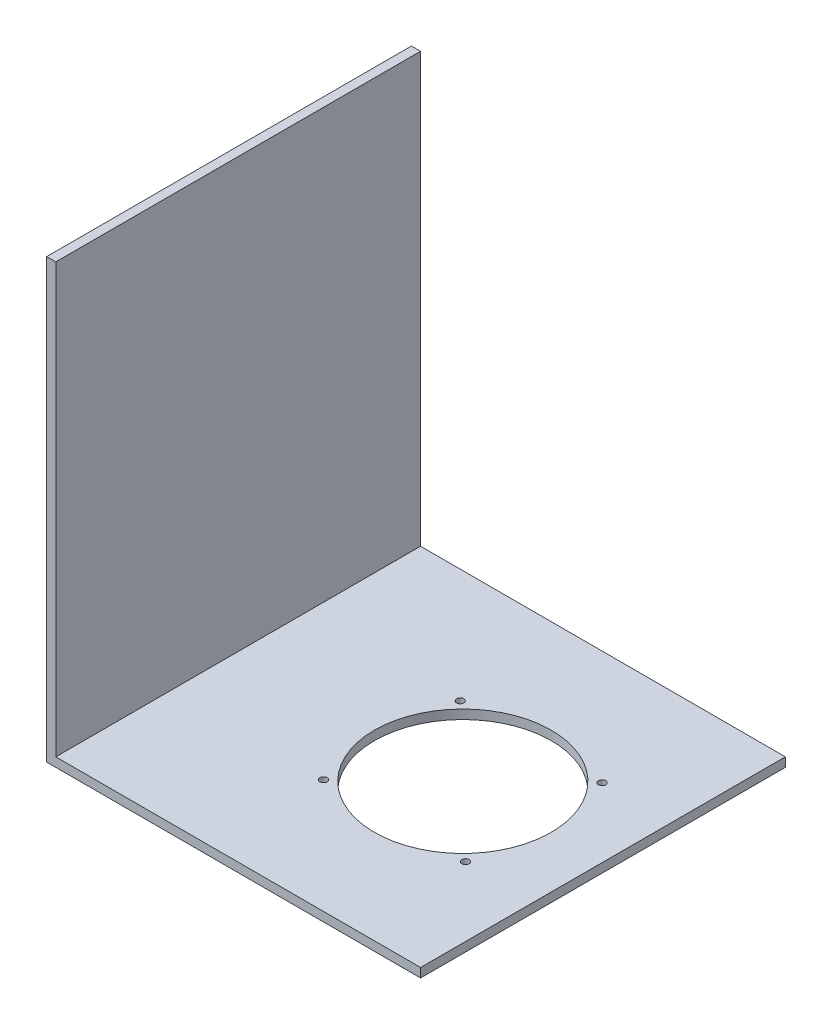
from build123d import *

# Parameters (mm, degrees)
BOSS_EXTRUDE1_DEPTH = 200
CUT_EXTRUDE1_REACH  = 372.473
SKETCH2_R           = 48.5
SKETCH2_R_2         = 2


with BuildPart() as part:
    # Sketch1 → Boss-Extrude1 (new body)
    with BuildSketch(Plane.XY):
        Polygon((0, 240), (0, 0), (205, 0), (205, 5), (5, 5), (5, 240), align=None)
    extrude(amount=BOSS_EXTRUDE1_DEPTH)

    # Sketch2 → Cut-Extrude1 (cut, up to next)
    with BuildSketch(Plane(origin=(0, 5, 0), x_dir=(1, 0, 0), z_dir=(0, 1, 0)), mode=Mode.PRIVATE) as cut_extrude1_sk1:
        with Locations((128.16761425, -100)):
            Circle(SKETCH2_R)
    cut_extrude1_tool1 = extrude(cut_extrude1_sk1.sketch, amount=-CUT_EXTRUDE1_REACH, mode=Mode.PRIVATE) & part.part
    # Sketch2 → Cut-Extrude1 (cut, up to next)
    with BuildSketch(Plane(origin=(0, 5, 0), x_dir=(1, 0, 0), z_dir=(0, 1, 0)), mode=Mode.PRIVATE) as cut_extrude1_sk2:
        with Locations((89.277796733, -62.535588975)):
            Circle(SKETCH2_R_2)
    cut_extrude1_tool2 = extrude(cut_extrude1_sk2.sketch, amount=-CUT_EXTRUDE1_REACH, mode=Mode.PRIVATE) & part.part
    # Sketch2 → Cut-Extrude1 (cut, up to next)
    with BuildSketch(Plane(origin=(0, 5, 0), x_dir=(1, 0, 0), z_dir=(0, 1, 0)), mode=Mode.PRIVATE) as cut_extrude1_sk3:
        with Locations((167.057431768, -62.535588975)):
            Circle(SKETCH2_R_2)
    cut_extrude1_tool3 = extrude(cut_extrude1_sk3.sketch, amount=-CUT_EXTRUDE1_REACH, mode=Mode.PRIVATE) & part.part
    # Sketch2 → Cut-Extrude1 (cut, up to next)
    with BuildSketch(Plane(origin=(0, 5, 0), x_dir=(1, 0, 0), z_dir=(0, 1, 0)), mode=Mode.PRIVATE) as cut_extrude1_sk4:
        with Locations((89.277796733, -137.464411025)):
            Circle(SKETCH2_R_2)
    cut_extrude1_tool4 = extrude(cut_extrude1_sk4.sketch, amount=-CUT_EXTRUDE1_REACH, mode=Mode.PRIVATE) & part.part
    # Sketch2 → Cut-Extrude1 (cut, up to next)
    with BuildSketch(Plane(origin=(0, 5, 0), x_dir=(1, 0, 0), z_dir=(0, 1, 0)), mode=Mode.PRIVATE) as cut_extrude1_sk5:
        with Locations((167.057431768, -137.464411025)):
            Circle(SKETCH2_R_2)
    cut_extrude1_tool5 = extrude(cut_extrude1_sk5.sketch, amount=-CUT_EXTRUDE1_REACH, mode=Mode.PRIVATE) & part.part
    add(cut_extrude1_tool1.solids().sort_by_distance((128.167614, 5, 100))[0], mode=Mode.SUBTRACT)
    add(cut_extrude1_tool2.solids().sort_by_distance((89.277797, 5, 62.535589))[0], mode=Mode.SUBTRACT)
    add(cut_extrude1_tool3.solids().sort_by_distance((167.057432, 5, 62.535589))[0], mode=Mode.SUBTRACT)
    add(cut_extrude1_tool4.solids().sort_by_distance((89.277797, 5, 137.464411))[0], mode=Mode.SUBTRACT)
    add(cut_extrude1_tool5.solids().sort_by_distance((167.057432, 5, 137.464411))[0], mode=Mode.SUBTRACT)


solid = part.part
